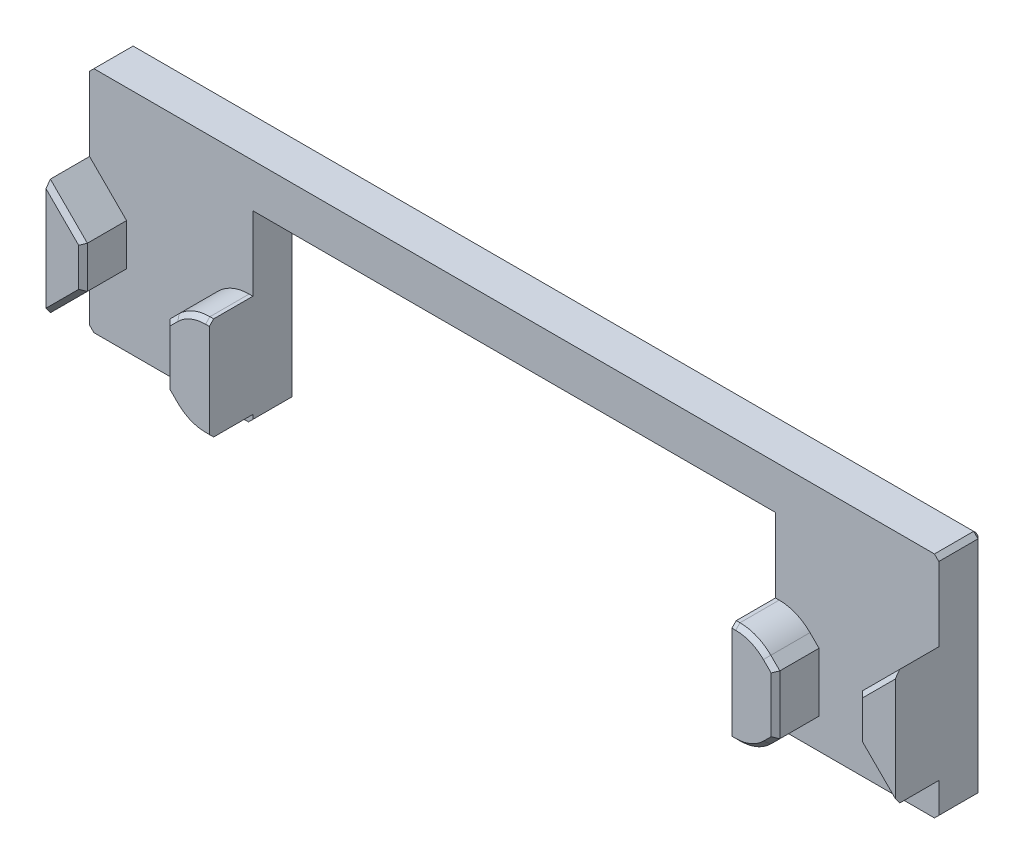
from build123d import *

# Parameters (mm, degrees)
BOSS_EXTRUDE1_DEPTH = 2
BOSS_EXTRUDE3_DEPTH = 2
ALIGNER_DEPTH       = 2
DEBURS_SIZE         = 0.2


with BuildPart() as part:
    # Sketch1 → Boss-Extrude1 (new body)
    with BuildSketch(Plane.XY):
        Polygon((-19.3, 5.25), (19.3, 5.25), (19.5, 5.05), (19.5, -5.05), (19.3, -5.25), (12.2, -5.25), (12, -5.05), (12, 3.25), (-12, 3.25), (-12, -5.05), (-12.2, -5.25), (-19.3, -5.25), (-19.5, -5.05), (-19.5, 5.05), align=None)
    extrude(amount=-BOSS_EXTRUDE1_DEPTH)

    # Sketch3 → Boss-Extrude3 (add)
    with BuildSketch(Plane.XY):
        with BuildLine():
            Line((12, -0.15), (12, -4.85))
            Line((12, -4.85), (12.171572875, -4.85))
            ThreePointArc((12.171572875, -4.85), (12.93693974, -4.697759065), (13.585786438, -4.264213562))
            Line((13.585786438, -4.264213562), (14, -3.85))
            Line((14, -3.85), (14, -1.15))
            Line((14, -1.15), (13.585786438, -0.735786438))
            ThreePointArc((13.585786438, -0.735786438), (12.93693974, -0.302240935), (12.171572875, -0.15))
            Line((12.171572875, -0.15), (12, -0.15))
        make_face()
    boss_extrude3 = extrude(amount=BOSS_EXTRUDE3_DEPTH)

    # Mirror3: Boss-Extrude3 across plane
    add(boss_extrude3.mirror(Plane(origin=(0, 0, 0), x_dir=(0, 0, 1), z_dir=(1, 0, 0))))

    # Sketch4 → Aligner (add)
    with BuildSketch(Plane.XY):
        Polygon((19.4, 1.558578644), (19.5, 1.658578644), (19.5, -3.658578644), (19.4, -3.558578644), (17.8, -1.958578644), (17.8, -0.041421356), align=None)
    aligner = extrude(amount=ALIGNER_DEPTH)

    # Aligners: Aligner across plane
    add(aligner.mirror(Plane(origin=(0, 0, 0), x_dir=(0, 0, 1), z_dir=(1, 0, 0))))

    # Deburs
    deburs_edges = [part.edges().sort_by_distance(p)[0] for p in [
        (12, -0.9, -2),
        (12.1, -5.15, -2),
        (15.75, -5.25, -2),
        (19.4, -5.15, -2),
        (19.5, 0, -2),
        (19.4, 5.15, -2),
        (0, 5.25, -2),
        (-19.4, 5.15, -2),
        (-19.5, 0, -2),
        (-19.4, -5.15, -2),
        (-15.75, -5.25, -2),
        (-12.1, -5.15, -2),
        (-12, -0.9, -2),
        (0, 3.25, -2),
        (-18.65, 0.808578644, 2),
        (-18.65, -2.808578644, 2),
        (-17.8, -1, 2),
        (-12.085786438, -4.85, 2),
        (-12.085786438, -0.15, 2),
        (-12.93693974, -4.697759065, 2),
        (-12.93693974, -0.302240935, 2),
        (-13.792893219, -4.057106781, 2),
        (-14, -2.5, 2),
        (-13.792893219, -0.942893219, 2),
        (18.65, -2.808578644, 2),
        (17.8, -1, 2),
        (18.65, 0.808578644, 2),
        (12.085786438, -4.85, 2),
        (13.792893219, -4.057106781, 2),
        (12.93693974, -4.697759065, 2),
        (12.085786438, -0.15, 2),
        (12.93693974, -0.302240935, 2),
        (14, -2.5, 2),
        (13.792893219, -0.942893219, 2),
    ]]
    chamfer(deburs_edges, length=DEBURS_SIZE)


solid = part.part
